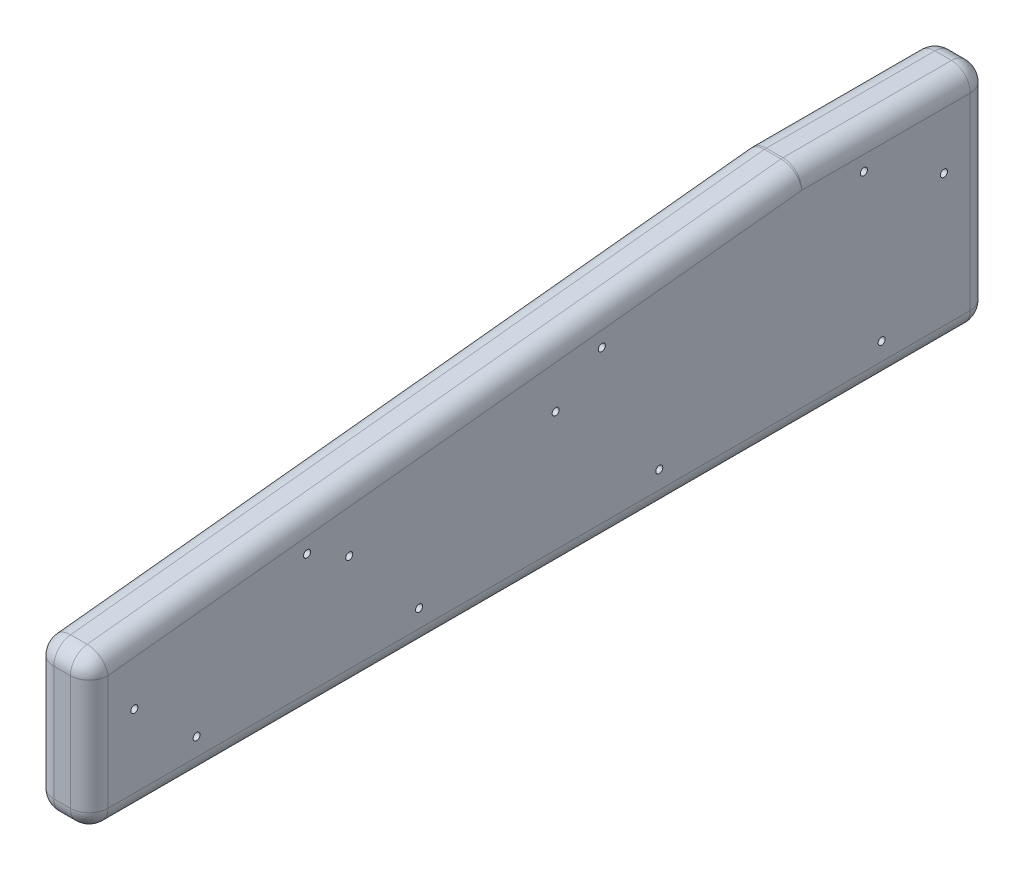
from build123d import *

# Parameters (mm, degrees)
BOSS_EXTRUDE1_DEPTH                 = 18.288
FILLET1_R                           = 6.35
F_3_32_0_09375_DIAMETER_HOLE2_D     = 2.38125
F_3_32_0_09375_DIAMETER_HOLE2_DEPTH = 10.0000054
F_3_32_0_09375_DIAMETER_HOLE2_TIP   = 0.715399675
F_3_32_0_09375_DIAMETER_HOLE3_D     = 2.38125
F_3_32_0_09375_DIAMETER_HOLE3_DEPTH = 9.906
F_3_32_0_09375_DIAMETER_HOLE3_TIP   = 0.715399675
F_3_32_0_09375_DIAMETER_HOLE4_D     = 2.38125
F_3_32_0_09375_DIAMETER_HOLE4_DEPTH = 9.906
F_3_32_0_09375_DIAMETER_HOLE4_TIP   = 0.715399675
F_3_32_0_09375_DIAMETER_HOLE5_D     = 2.38125
F_3_32_0_09375_DIAMETER_HOLE5_DEPTH = 9.906
F_3_32_0_09375_DIAMETER_HOLE5_TIP   = 0.715399675


with BuildPart() as part:
    # Sketch1 → Boss-Extrude1 (new body)
    with BuildSketch(Plane(origin=(0, 0, 0), x_dir=(0, 0, -1), z_dir=(1, 0, 0))):
        with BuildLine():
            Line((-166.973473818, -57.646230654), (123.785960254, -57.646230654))
            ThreePointArc((123.785960254, -57.646230654), (128.276088314, -55.786358715), (130.135960254, -51.296230654))
            Line((130.135960254, -51.296230654), (130.135960254, 12.203769346))
            ThreePointArc((130.135960254, 12.203769346), (128.276088314, 16.693897406), (123.785960254, 18.553769346))
            Line((123.785960254, 18.553769346), (66.971101736, 18.553769346))
            ThreePointArc((66.971101736, 18.553769346), (66.636426055, 18.5449437), (66.302680683, 18.518491295))
            Line((66.302680683, 18.518491295), (-167.641894871, -6.244828564))
            ThreePointArc((-167.641894871, -6.244828564), (-171.694012648, -8.31231457), (-173.323473818, -12.559550513))
            Line((-173.323473818, -12.559550513), (-173.323473818, -51.296230654))
            ThreePointArc((-173.323473818, -51.296230654), (-171.463601879, -55.786358715), (-166.973473818, -57.646230654))
        make_face()
    extrude(amount=BOSS_EXTRUDE1_DEPTH)

    # Fillet1
    fillet1_edges = [part.edges().sort_by_distance(p)[0] for p in [
        (0, 16.693897406, -128.276088314),
        (0, -19.546230654, -130.135960254),
        (0, -55.786358715, -128.276088314),
        (0, -57.646230654, 21.593756782),
        (0, -55.786358715, 171.463601879),
        (0, -31.927890584, 173.323473818),
        (0, -8.31231457, 171.694012648),
        (0, 6.136831366, 50.669607094),
        (0, 18.5449437, -66.636426055),
        (18.288, 18.5449437, -66.636426055),
        (18.288, 18.553769346, -95.378530995),
        (18.288, 16.693897406, -128.276088314),
        (18.288, -19.546230654, -130.135960254),
        (18.288, -55.786358715, -128.276088314),
        (18.288, -57.646230654, 21.593756782),
        (18.288, -55.786358715, 171.463601879),
        (18.288, -31.927890584, 173.323473818),
        (18.288, -8.31231457, 171.694012648),
        (0, 18.553769346, -95.378530995),
        (18.288, 6.136831366, 50.669607094),
    ]]
    fillet(fillet1_edges, radius=FILLET1_R)

    # 3/32 (0.09375) Diameter Hole2
    with Locations(Plane(origin=(18.288, 0, 0), x_dir=(0, 0, -1), z_dir=(1, 0, 0))):
        with Locations((-16.007823751, -10.949484573), (-85.618931853, -18.317905626)):
            Hole(F_3_32_0_09375_DIAMETER_HOLE2_D / 2, depth=F_3_32_0_09375_DIAMETER_HOLE2_DEPTH)
            with Locations((0, 0, -(F_3_32_0_09375_DIAMETER_HOLE2_DEPTH + F_3_32_0_09375_DIAMETER_HOLE2_TIP / 2))):  # 118° drill point
                Cone(0, F_3_32_0_09375_DIAMETER_HOLE2_D / 2, F_3_32_0_09375_DIAMETER_HOLE2_TIP, mode=Mode.SUBTRACT)

    # 3/32 (0.09375) Diameter Hole3
    with Locations(Plane(origin=(18.288, 0, 0), x_dir=(0, 0, -1), z_dir=(1, 0, 0))):
        with Locations((114.925190393, -6.796230654), (-158.074809607, -26.796230654)):
            Hole(F_3_32_0_09375_DIAMETER_HOLE3_D / 2, depth=F_3_32_0_09375_DIAMETER_HOLE3_DEPTH)
            with Locations((0, 0, -(F_3_32_0_09375_DIAMETER_HOLE3_DEPTH + F_3_32_0_09375_DIAMETER_HOLE3_TIP / 2))):  # 118° drill point
                Cone(0, F_3_32_0_09375_DIAMETER_HOLE3_D / 2, F_3_32_0_09375_DIAMETER_HOLE3_TIP, mode=Mode.SUBTRACT)

    # 3/32 (0.09375) Diameter Hole4
    with Locations(Plane(origin=(18.288, 0, 0), x_dir=(0, 0, -1), z_dir=(1, 0, 0))):
        with Locations((93.924468997, -45.296232872), (18.924468997, -45.296232872), (-62.074800328, -45.296232872), (-137.074800328, -45.296232872)):
            Hole(F_3_32_0_09375_DIAMETER_HOLE4_D / 2, depth=F_3_32_0_09375_DIAMETER_HOLE4_DEPTH)
            with Locations((0, 0, -(F_3_32_0_09375_DIAMETER_HOLE4_DEPTH + F_3_32_0_09375_DIAMETER_HOLE4_TIP / 2))):  # 118° drill point
                Cone(0, F_3_32_0_09375_DIAMETER_HOLE4_D / 2, F_3_32_0_09375_DIAMETER_HOLE4_TIP, mode=Mode.SUBTRACT)

    # 3/32 (0.09375) Diameter Hole5
    with Locations(Plane(origin=(18.288, 0, 0), x_dir=(0, 0, -1), z_dir=(1, 0, 0))):
        with Locations((87.93134055, 7.163769346), (-0.456111434, -0.001640397), (-99.83035199, -10.520525474)):
            Hole(F_3_32_0_09375_DIAMETER_HOLE5_D / 2, depth=F_3_32_0_09375_DIAMETER_HOLE5_DEPTH)
            with Locations((0, 0, -(F_3_32_0_09375_DIAMETER_HOLE5_DEPTH + F_3_32_0_09375_DIAMETER_HOLE5_TIP / 2))):  # 118° drill point
                Cone(0, F_3_32_0_09375_DIAMETER_HOLE5_D / 2, F_3_32_0_09375_DIAMETER_HOLE5_TIP, mode=Mode.SUBTRACT)


solid = part.part
